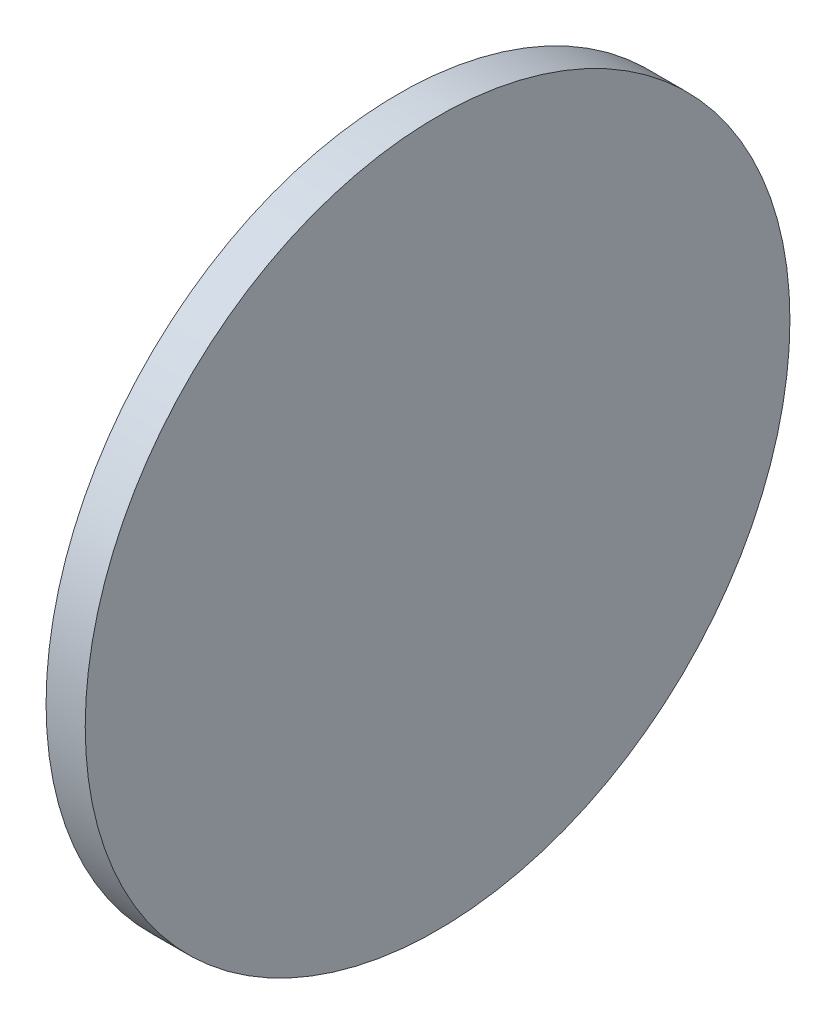
from build123d import *

# Parameters (mm, degrees)
SKETCH1_R           = 57.15
BOSS_EXTRUDE1_DEPTH = 6.35
SKETCH2_R           = 45.847
BOSS_EXTRUDE2_DEPTH = 6.35


with BuildPart() as part:
    # Sketch1 → Boss-Extrude1 (new body)
    with BuildSketch(Plane(origin=(0, 0, 0), x_dir=(0, 0, -1), z_dir=(1, 0, 0))):
        Circle(SKETCH1_R)
    extrude(amount=BOSS_EXTRUDE1_DEPTH)

    # Sketch2 → Boss-Extrude2 (add)
    with BuildSketch(Plane.ZY):
        Circle(SKETCH2_R)
    extrude(amount=BOSS_EXTRUDE2_DEPTH)


solid = part.part
